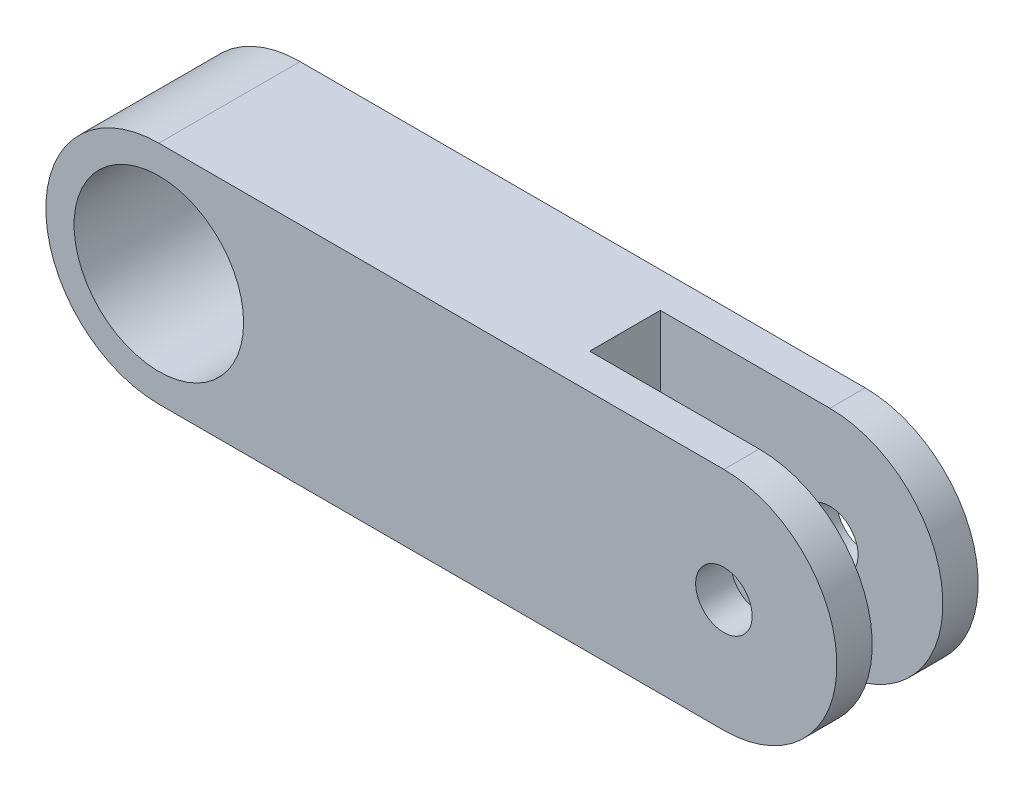
from build123d import *

# Parameters (mm, degrees)
SKETCH1_R           = 3
SKETCH1_R_2         = 1
BOSS_EXTRUDE1_DEPTH = 2.5
SKETCH5_W           = 10
SKETCH5_H           = 8
CUT_EXTRUDE1_DEPTH  = 1.25


with BuildPart() as part:
    # Sketch1 → Boss-Extrude1 (new, symmetric)
    with BuildSketch(Plane.XY):
        with BuildLine():
            Line((-10, 4), (10, 4))
            ThreePointArc((10, 4), (14, 0), (10, -4))
            Line((10, -4), (-10, -4))
            ThreePointArc((-10, -4), (-14, 0), (-10, 4))
        make_face()
        with Locations((-10, 0)):
            Circle(SKETCH1_R, mode=Mode.SUBTRACT)
        with Locations((10, 0)):
            Circle(SKETCH1_R_2, mode=Mode.SUBTRACT)
    extrude(amount=BOSS_EXTRUDE1_DEPTH, both=True)

    # Sketch5 → Cut-Extrude1 (cut, symmetric)
    with BuildSketch(Plane.XY):
        with Locations((9, 0)):
            Rectangle(SKETCH5_W, SKETCH5_H)
    extrude(amount=CUT_EXTRUDE1_DEPTH, both=True, mode=Mode.SUBTRACT)


solid = part.part
